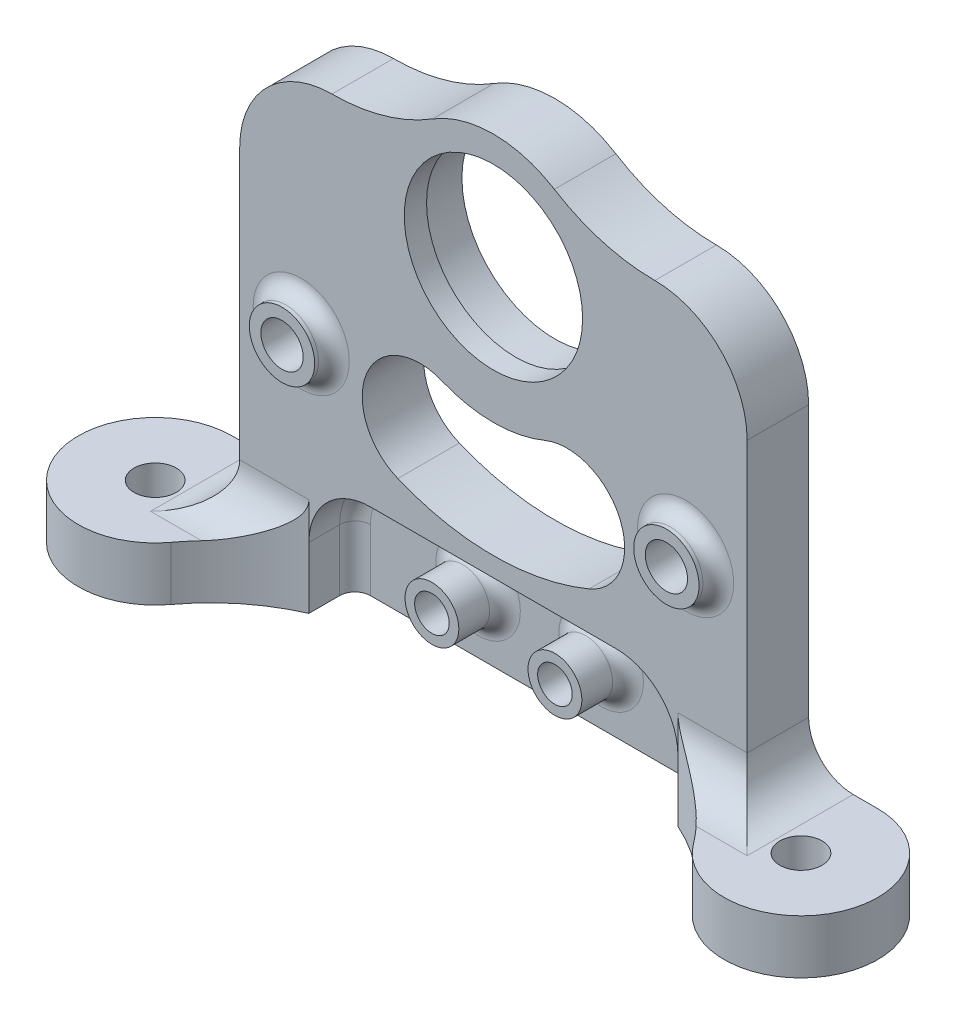
from build123d import *

# Parameters (mm, degrees)
SKETCH1_W           = 33
SKETCH1_H           = 66
BOSS_EXTRUDE1_DEPTH = 8
SKETCH3_R           = 2.75
SKETCH3_R_2         = 11.6
CUT_EXTRUDE1_DEPTH  = 62.269894728
BOSS_EXTRUDE3_START = 2.5
SKETCH4_R           = 4.25
SKETCH4_R_2         = 2.75
BOSS_EXTRUDE3_DEPTH = 2.5
SKETCH6_R           = 12.1
CUT_EXTRUDE2_DEPTH  = 5.1
CUT_EXTRUDE6_DEPTH  = 62.646167764
SKETCH10_R          = 2.75
BOSS_EXTRUDE4_DEPTH = 7
CUT_EXTRUDE3_DEPTH  = 6
SKETCH12_R          = 2.75
CUT_EXTRUDE4_DEPTH  = 6
FILLET7_R           = 2
FILLET5_R           = 25
FILLET6_R           = 5.8
SKETCH15_R          = 3.5
SKETCH15_R_2        = 2.25
BOSS_EXTRUDE5_DEPTH = 8
CUT_EXTRUDE5_DEPTH  = 5
FILLET8_R           = 2


with BuildPart() as part:
    # Sketch1 → Boss-Extrude1 (new body)
    with BuildSketch(Plane.XY):
        with Locations((16.5, -18)):
            Rectangle(SKETCH1_W, SKETCH1_H)
    extrude(amount=BOSS_EXTRUDE1_DEPTH)

    # Sketch3 → Cut-Extrude1 (cut, through all)
    with BuildSketch(Plane.XY.offset(8)):
        with Locations((25, -20)):
            Circle(SKETCH3_R)
        Circle(SKETCH3_R_2)
        with BuildLine():
            Line((-17.5, 0), (-32.5, 0))
            ThreePointArc((-32.5, 0), (-18.056032573, -27.0227624), (12.437211552, -30.026084807))
            ThreePointArc((12.437211552, -30.026084807), (16.496182303, -20.22686257), (6.696960066, -16.167891819))
            ThreePointArc((6.696960066, -16.167891819), (-9.722479078, -14.550718215), (-17.5, 0))
        make_face()
    extrude(amount=-CUT_EXTRUDE1_DEPTH, mode=Mode.SUBTRACT)

    # Sketch4 → Boss-Extrude3 (add)
    with BuildSketch(Plane.XY.offset(8).offset(BOSS_EXTRUDE3_START)):
        with Locations((25, -20)):
            Circle(SKETCH4_R)
        with Locations((25, -20)):
            Circle(SKETCH4_R_2, mode=Mode.SUBTRACT)
    extrude(amount=-BOSS_EXTRUDE3_DEPTH)

    # Sketch6 → Cut-Extrude2 (cut)
    with BuildSketch(Plane(origin=(0, 0, 0), x_dir=(-1, 0, 0), z_dir=(0, 0, -1))):
        Circle(SKETCH6_R)
    extrude(amount=-CUT_EXTRUDE2_DEPTH, mode=Mode.SUBTRACT)

    # Sketch17 → Cut-Extrude6 (cut, through all)
    with BuildSketch(Plane(origin=(0, 0, 0), x_dir=(-1, 0, 0), z_dir=(0, 0, -1))):
        with BuildLine():
            Line((0, 15), (0, 35))
            Line((0, 35), (-33, 35))
            Line((-33, 35), (-33, -3))
            ThreePointArc((-33, -3), (-29.485281374, 5.485281374), (-21, 9))
            ThreePointArc((-21, 9), (-14.200652085, 9.952282296), (-7.924528302, 12.735849057))
            ThreePointArc((-7.924528302, 12.735849057), (-4.120816918, 14.422859215), (0, 15))
        make_face()
    extrude(amount=-CUT_EXTRUDE6_DEPTH, mode=Mode.SUBTRACT)

    # Sketch10 → Boss-Extrude4 (add)
    with BuildSketch(Plane.XZ.offset(51)):
        with BuildLine():
            Line((42, 0), (32, 0))
            Line((32, 0), (32, 10))
            ThreePointArc((32, 10), (49.071067812, 17.071067812), (42, 0))
        make_face()
        with Locations(Location((42, 10, 0), (0, 0, 270))):
            Circle(SKETCH10_R, mode=Mode.SUBTRACT)
    extrude(amount=-BOSS_EXTRUDE4_DEPTH)

    # Sketch11 → Cut-Extrude3 (cut)
    with BuildSketch(Plane.XY.offset(8)):
        with BuildLine():
            Line((0, -51), (24, -51))
            Line((24, -51), (24, -43))
            ThreePointArc((24, -43), (21.656854249, -37.343145751), (16, -35))
            Line((16, -35), (0, -35))
            Line((0, -35), (0, -51))
        make_face()
    extrude(amount=-CUT_EXTRUDE3_DEPTH, mode=Mode.SUBTRACT)

    # Sketch12 → Cut-Extrude4 (cut)
    with BuildSketch(Plane.XY.offset(2)):
        with Locations((8, -43)):
            Circle(SKETCH12_R)
    extrude(amount=-CUT_EXTRUDE4_DEPTH, mode=Mode.SUBTRACT)

    # Fillet7
    fillet7_edges = [part.edges().sort_by_distance(p)[0] for p in [
        (8, -35, 2),
        (21.656854249, -37.343145751, 2),
        (24, -47, 2),
    ]]
    fillet(fillet7_edges, radius=FILLET7_R)

    # Fillet5
    # the kernel refuses this fillet: 25 mm, written as the material it adds along each edge
    with BuildSketch(Plane(origin=(32, -44, 8), x_dir=(-1, 0, 0), z_dir=(0, -1, 0))) as fillet5_piece_1:
        with BuildLine():
            CenterArc((18.096713956, -22.870425604), FILLET5_R, 113.820244592, 29.574545381)
            Line((-1.972367441, -7.962978744), (-3.979275581, -6.472234058))
            ThreePointArc((-3.979275581, -6.472234058), (-2.5, -2), (-2.5, 0))
            Line((-2.5, 0), (0, 2.5))
            ThreePointArc((0, 2.5), (4, 2.5), (6.990328604, 2.28704256))
            Line((6.990328604, 2.28704256), (8, 0))
        make_face()
    extrude(amount=7)

    # Fillet6
    # the kernel refuses this fillet: 5.8 mm, written as the material it adds along each edge
    with BuildSketch(Plane(origin=(33, -44, 0), x_dir=(0, 1, 0), z_dir=(0, 0, 1))) as fillet6_piece_1:
        with BuildLine():
            CenterArc((FILLET6_R, -FILLET6_R), FILLET6_R, 90, 90)
            Line((0, -FILLET6_R), (0, 0))
            Line((0, 0), (FILLET6_R, 0))
        make_face()
    extrude(amount=8)
    with BuildSketch(Plane(origin=(33, -44, 8), x_dir=(0, 1, 0), z_dir=(-1, 0, 0))) as fillet6_piece_2_section:
        with BuildLine():
            CenterArc((FILLET6_R, -FILLET6_R), FILLET6_R, 90, 90)
            Line((0, -FILLET6_R), (0, 0))
            Line((0, 0), (FILLET6_R, 0))
        make_face()
    fillet6_piece_2 = extrude(amount=23.5, mode=Mode.PRIVATE)
    fillet6_piece_2 = fillet6_piece_2 - Plane(origin=(13.903286044, -44, 30.870425604), x_dir=(-1, 0, 0), z_dir=(0, 1, 0)) * Cylinder(25, 71, mode=Mode.PRIVATE)
    add(fillet6_piece_2)
    with BuildSketch(Plane(origin=(47.5, -44, 8), x_dir=(0, 1, 0), z_dir=(-1, 0, 0))) as fillet6_piece_3a_section:
        with BuildLine():
            CenterArc((FILLET6_R, -FILLET6_R), FILLET6_R, 90, 90)
            Line((0, -FILLET6_R), (0, 0))
            Line((0, 0), (FILLET6_R, 0))
        make_face()
    fillet6_piece_3a = extrude(amount=23.5, mode=Mode.PRIVATE)
    fillet6_piece_3a = fillet6_piece_3a - Plane(origin=(42, -44, 10), x_dir=(0, 0, -1), z_dir=(0, -1, 0)) * Cylinder(2.75, 71, mode=Mode.PRIVATE)
    fillet6_piece_3a = split(fillet6_piece_3a, bisect_by=Plane(origin=(33, -44, 8), z_dir=(1, 0, 0)), keep=Keep.TOP, mode=Mode.PRIVATE)
    with BuildSketch(Plane(origin=(33, -44, 0), x_dir=(0, 1, 0), z_dir=(0, 0, 1))) as fillet6_piece_3b_section:
        with BuildLine():
            CenterArc((FILLET6_R, -FILLET6_R), FILLET6_R, 90, 90)
            Line((0, -FILLET6_R), (0, 0))
            Line((0, 0), (FILLET6_R, 0))
        make_face()
    fillet6_piece_3b = extrude(amount=22.5, mode=Mode.PRIVATE)
    fillet6_piece_3b = split(fillet6_piece_3b, bisect_by=Plane(origin=(33, -44, 8), z_dir=(0, 0, 1)), keep=Keep.TOP, mode=Mode.PRIVATE)
    fillet6_piece_3b = fillet6_piece_3b & Plane(origin=(42, -44, 10), x_dir=(-1, 0, 0), z_dir=(0, -1, 0)) * Cylinder(10, 69, mode=Mode.PRIVATE)
    fillet6_piece_3 = fillet6_piece_3a & fillet6_piece_3b
    add(fillet6_piece_3)

    # Sketch15 → Boss-Extrude5 (add)
    with BuildSketch(Plane.XY):
        with Locations(Location((8, -43, 0), (0, 0, 180))):
            Circle(SKETCH15_R)
        with Locations(Location((8, -43, 0), (0, 0, 180))):
            Circle(SKETCH15_R_2, mode=Mode.SUBTRACT)
    extrude(amount=BOSS_EXTRUDE5_DEPTH)

    # Sketch13 → Cut-Extrude5 (cut)
    with BuildSketch(Plane(origin=(0, 0, 0), x_dir=(-1, 0, 0), z_dir=(0, 0, -1))):
        Polygon((-22.546261356, -15.75), (-27.453738644, -15.75), (-29.907477288, -20), (-27.453738644, -24.25), (-22.546261356, -24.25), (-20.092522712, -20), align=None)
    extrude(amount=-CUT_EXTRUDE5_DEPTH, mode=Mode.SUBTRACT)

    # Fillet8
    fillet8_edges = [part.edges().sort_by_distance(p)[0] for p in [
        (11.5, -43, 2),
        (20.75, -20, 8),
    ]]
    fillet(fillet8_edges, radius=FILLET8_R)

    # Mirror1: part across plane


with BuildPart() as part_1:
    add(part.part)
    add(part.part.mirror(Plane(origin=(0, 15, 8), x_dir=(0, 0, 1), z_dir=(1, 0, 0))))


solid = part_1.part
